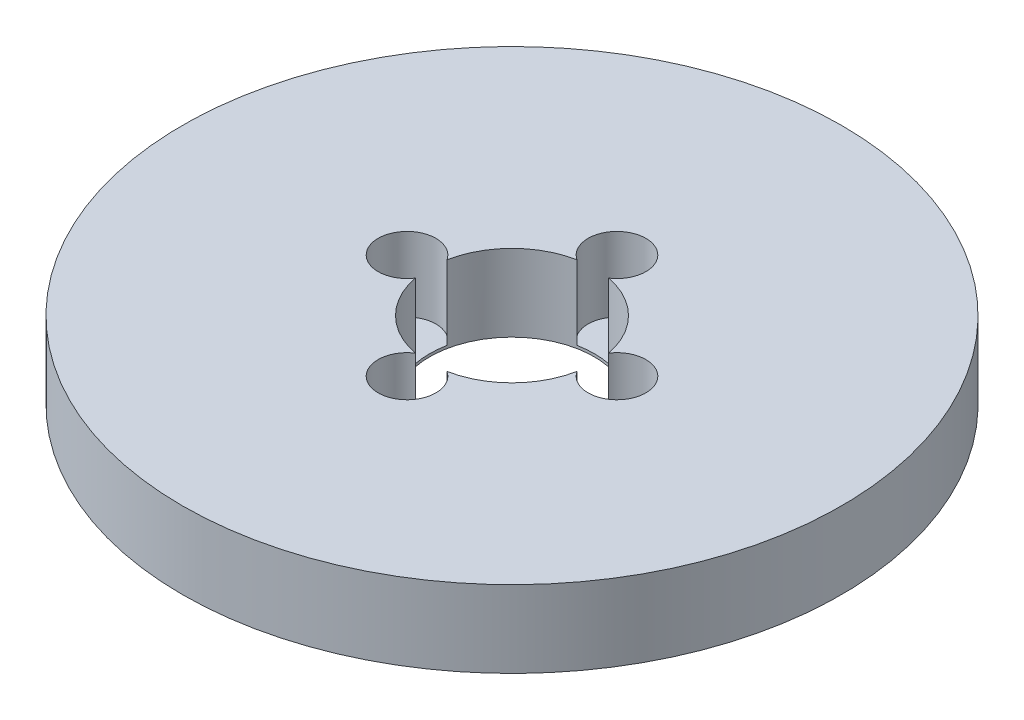
from build123d import *

# Parameters (mm, degrees)
SKETCH1_R           = 30
BOSS_EXTRUDE1_DEPTH = 7
SKETCH2_R           = 7.5
CUT_EXTRUDE1_DEPTH  = 44
SKETCH3_R           = 2.629435514
CUT_EXTRUDE2_DEPTH  = 6.751971175
CIRPATTERN1_COUNT   = 4


with BuildPart() as part:
    # Sketch1 → Boss-Extrude1 (new body)
    with BuildSketch(Plane(origin=(0, 0, 0), x_dir=(1, 0, 0), z_dir=(0, 1, 0))):
        Circle(SKETCH1_R)
    extrude(amount=BOSS_EXTRUDE1_DEPTH)

    # Sketch2 → Cut-Extrude1 (cut, through all)
    with BuildSketch(Plane(origin=(0, 0, 0), x_dir=(1, 0, 0), z_dir=(0, 1, 0))):
        Circle(SKETCH2_R)
    extrude(amount=CUT_EXTRUDE1_DEPTH, mode=Mode.SUBTRACT)

    # Sketch3 → Cut-Extrude2 (cut)
    with BuildSketch(Plane(origin=(0, 7, 0), x_dir=(1, 0, 0), z_dir=(0, 1, 0))):
        with Locations((-9.557372141, 0)):
            Circle(SKETCH3_R)
    cut_extrude2 = extrude(amount=-CUT_EXTRUDE2_DEPTH, mode=Mode.SUBTRACT)

    # CirPattern1: Cut-Extrude2 ×4 about axis
    cirpattern1_axis = Axis((0, 0, 0), (0, 1, 0))
    for i in range(1, CIRPATTERN1_COUNT):
        add(cut_extrude2.rotate(cirpattern1_axis, i * 360 / CIRPATTERN1_COUNT), mode=Mode.SUBTRACT)


solid = part.part
